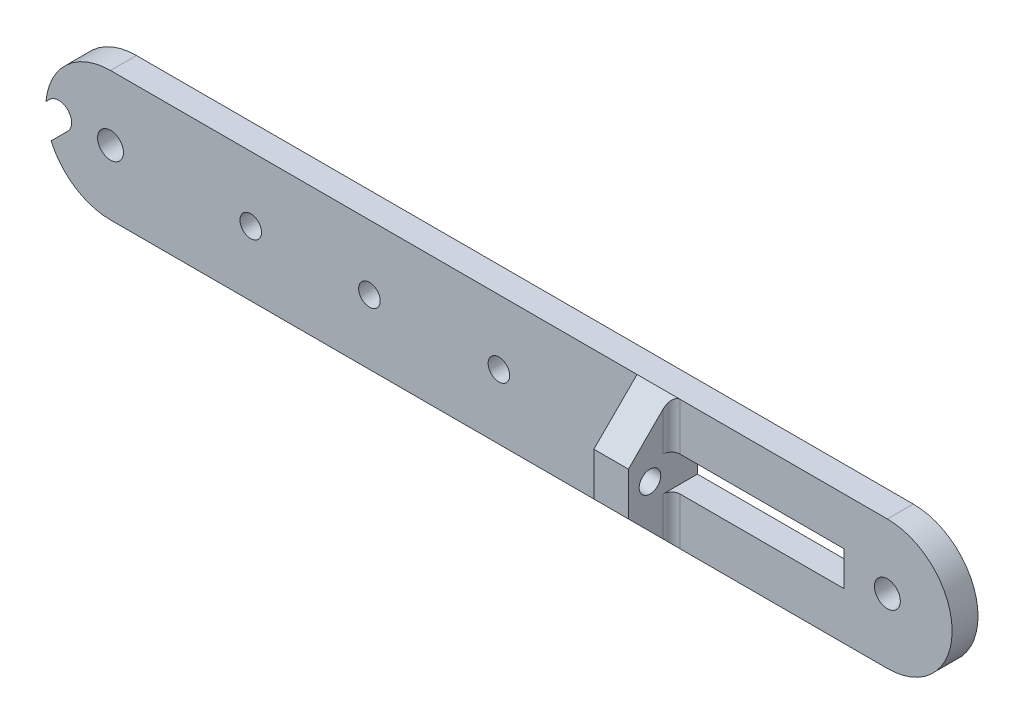
from build123d import *

# Parameters (mm, degrees)
ESQUISSE1_R             = 3
ESQUISSE1_R_2           = 2.5
ESQUISSE1_W             = 40
ESQUISSE1_H             = 8
BOSS_EXTRU_1_DEPTH      = 6
ESQUISSE2_R             = 2.5
BOSS_EXTRU_2_DEPTH      = 8
CONG_2_R                = 2
ENL_V_MAT_EXTRU_1_DEPTH = 4
ENL_V_START             = -10
ENL_V_MAT_EXTRU_4_DEPTH = 10


with BuildPart() as part:
    # Esquisse1 → Boss.-Extru.1 (new body)
    with BuildSketch(Plane.XY):
        with BuildLine():
            Line((90, -15), (-90, -15))
            ThreePointArc((-90, -15), (-105, 0), (-90, 15))
            Line((-90, 15), (90, 15))
            ThreePointArc((90, 15), (105, 0), (90, -15))
        make_face()
        with Locations((90, 0)):
            Circle(ESQUISSE1_R, mode=Mode.SUBTRACT)
        with Locations((-90, 0)):
            Circle(ESQUISSE1_R, mode=Mode.SUBTRACT)
        Circle(ESQUISSE1_R_2, mode=Mode.SUBTRACT)
        with Locations((-57.5, 0)):
            Circle(ESQUISSE1_R_2, mode=Mode.SUBTRACT)
        with Locations((-30, 0)):
            Circle(ESQUISSE1_R_2, mode=Mode.SUBTRACT)
        with Locations((60, 0)):
            Rectangle(ESQUISSE1_W, ESQUISSE1_H, mode=Mode.SUBTRACT)
    extrude(amount=BOSS_EXTRU_1_DEPTH)

    # Esquisse2 → Boss.-Extru.2 (add)
    with BuildSketch(Plane(origin=(40, 0, 0), x_dir=(0, 0, -1), z_dir=(1, 0, 0))):
        Polygon((-16, 5), (-16, -5), (-6, -15), (-6, -5), (-6, 5), (-6, 15), align=None)
        with Locations((-11, 0)):
            Circle(ESQUISSE2_R, mode=Mode.SUBTRACT)
    extrude(amount=-BOSS_EXTRU_2_DEPTH)

    # Congé2
    cong_2_edges = [part.edges().sort_by_distance(p)[0] for p in [
        (40, 9.5, 6),
        (40, -9.5, 6),
    ]]
    fillet(cong_2_edges, radius=CONG_2_R)

    # Esquisse3 → Enlèv. mat.-Extru.1 (cut)
    with BuildSketch(Plane.ZY.offset(-32)):
        Polygon((11, 4), (14.464101615, 2), (14.464101615, -2), (11, -4), (7.535898385, -2), (7.535898385, 2), align=None)
    extrude(amount=-ENL_V_MAT_EXTRU_1_DEPTH, mode=Mode.SUBTRACT)

    # Esquisse4 → Enlèv. mat.-Extru.4 (cut)
    with BuildSketch(Plane.XY.offset(6).offset(ENL_V_START)):
        with BuildLine():
            Line((-103.750652313, -5.993293), (-99.878679656, -2.121320344))
            ThreePointArc((-99.878679656, -2.121320344), (-99.878679656, 2.121320344), (-104.121320344, 2.121320344))
            Line((-104.121320344, 2.121320344), (-104.94364809, 1.298992597))
            ThreePointArc((-104.94364809, 1.298992597), (-104.803211685, -2.421760475), (-103.750652313, -5.993293))
        make_face()
    extrude(amount=ENL_V_MAT_EXTRU_4_DEPTH, mode=Mode.SUBTRACT)


solid = part.part
